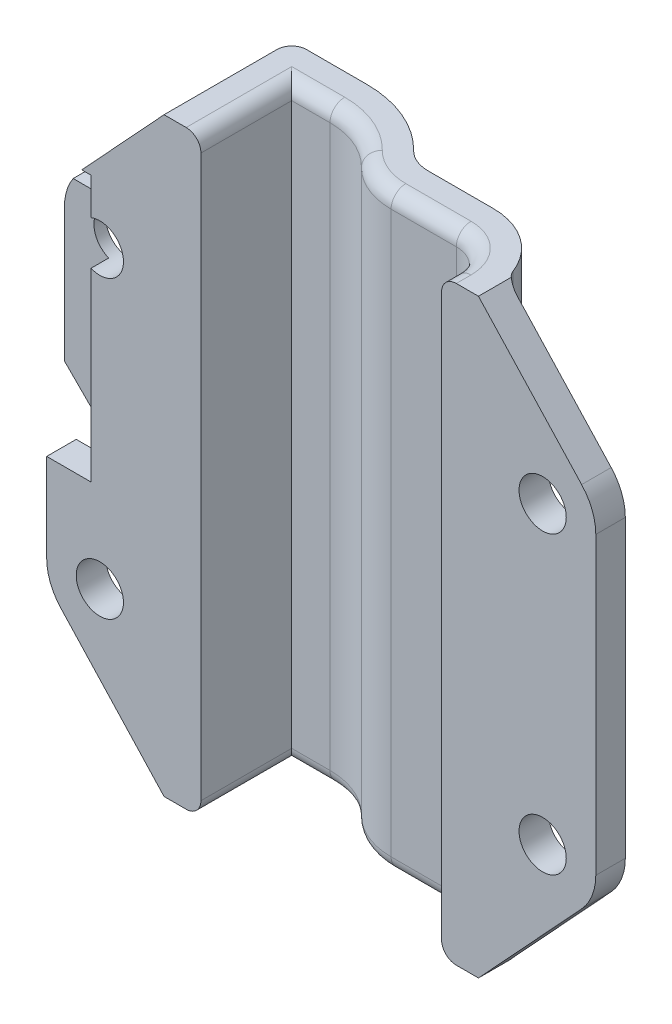
from build123d import *

# Parameters (mm, degrees)
BOSS_EXTRUDE1_DEPTH     = 40
BOSS_EXTRUDE2_START     = -2
BOSS_EXTRUDE2_OUTLINE_R = 1.6
BOSS_EXTRUDE2_DEPTH     = 2
FILLET1_R               = 1
FILLET2_R               = 1
SKETCH3_W               = 1.2
SKETCH3_H               = 2
SKETCH3_W_2             = 23.413110463
SKETCH3_H_2             = 14
CUT_EXTRUDE1_DEPTH      = 3
CHAMFER1_SIZE           = 3


# Read off the part's stored shape, not the designer's step: Boss-Extrude2
with BuildPart() as part:
    # Sketch1 → Boss-Extrude1 (new body)
    with BuildSketch(Plane(origin=(0, 0, 0), x_dir=(1, 0, 0), z_dir=(0, 1, 0))):
        with BuildLine():
            ThreePointArc((7.904340014, 6.355), (8.672424609, 5.833407053), (9.582575695, 5.65))
            Line((9.582575695, 5.65), (14, 5.65))
            ThreePointArc((14, 5.65), (17.288046533, 4.288046533), (18.65, 1))
            Line((18.65, 1), (18.65, 0))
            Line((18.65, 0), (16.15, 0))
            Line((16.15, 0), (16.15, 1))
            ThreePointArc((16.15, 1), (15.52027958, 2.52027958), (14, 3.15))
            Line((14, 3.15), (9.582575695, 3.15))
            ThreePointArc((9.582575695, 3.15), (7.704178772, 3.528520938), (6.118982907, 4.605))
            ThreePointArc((6.118982907, 4.605), (4.43573369, 5.748065396), (2.441147266, 6.15))
            Line((2.441147266, 6.15), (-0.15, 6.15))
            Line((-0.15, 6.15), (-0.15, 0))
            Line((-0.15, 0), (-2.65, 0))
            Line((-2.65, 0), (-2.65, 8.65))
            Line((-2.65, 8.65), (2.441147266, 8.65))
            ThreePointArc((2.441147266, 8.65), (5.403979526, 8.05295151), (7.904340014, 6.355))
        make_face()
    extrude(amount=BOSS_EXTRUDE1_DEPTH)

    # Boss-Extrude2 outline → Boss-Extrude2 (add)
    # profile 1 of 2: a face of its own
    with BuildSketch(Plane.XY.offset(BOSS_EXTRUDE2_START)):
        with BuildLine():
            Line((-2.65, 40), (-9.642066198, 32.445298796))
            ThreePointArc((-9.642066198, 32.445298796), (-10.351972428, 31.313118747), (-10.6, 30))
            Line((-10.6, 30), (-10.6, 10))
            ThreePointArc((-10.6, 10), (-10.351972428, 8.686881253), (-9.642066198, 7.554701204))
            Line((-9.642066198, 7.554701204), (-2.65, 0))
            Line((-2.65, 0), (-2.65, 40))
        make_face()
        with Locations((-7, 10)):
            Circle(BOSS_EXTRUDE2_OUTLINE_R, mode=Mode.SUBTRACT)
        with Locations((-7, 30)):
            Circle(BOSS_EXTRUDE2_OUTLINE_R, mode=Mode.SUBTRACT)
    # profile 2 of 2: a face of its own
    with BuildSketch(Plane.XY.offset(BOSS_EXTRUDE2_START)):
        with BuildLine():
            Line((26.6, 10), (26.6, 30))
            ThreePointArc((26.6, 30), (26.351972428, 31.313118747), (25.642066198, 32.445298796))
            Line((25.642066198, 32.445298796), (18.65, 40))
            Line((18.65, 40), (16.15, 40))
            Line((16.15, 40), (16.15, 0))
            Line((16.15, 0), (18.65, 0))
            Line((18.65, 0), (25.642066198, 7.554701204))
            ThreePointArc((25.642066198, 7.554701204), (26.351972428, 8.686881253), (26.6, 10))
        make_face()
        with Locations((23, 30)):
            Circle(BOSS_EXTRUDE2_OUTLINE_R, mode=Mode.SUBTRACT)
        with Locations((23, 10)):
            Circle(BOSS_EXTRUDE2_OUTLINE_R, mode=Mode.SUBTRACT)
    extrude(amount=BOSS_EXTRUDE2_DEPTH)

    # Fillet1
    fillet1_edges = [part.edges().sort_by_distance(p)[0] for p in [
        (-2.65, 20, -2),
        (-2.65, 20, -8.65),
        (18.541200282, 20, -2),
    ]]
    fillet(fillet1_edges, radius=FILLET1_R)

    # Fillet2
    fillet2_edges = [part.edges().sort_by_distance(p)[0] for p in [
        (16.15, 0, -0.5),
        (15.52027958, 0, -2.52027958),
        (11.791287847, 0, -3.15),
        (7.704178772, 0, -3.528520938),
        (4.43573369, 0, -5.748065396),
        (1.145573633, 0, -6.15),
        (-0.15, 0, -3.075),
        (-0.15, 40, -3.075),
        (1.145573633, 40, -6.15),
        (4.43573369, 40, -5.748065396),
        (7.704178772, 40, -3.528520938),
        (11.791287847, 40, -3.15),
        (15.52027958, 40, -2.52027958),
        (16.15, 40, -0.5),
    ]]
    fillet(fillet2_edges, radius=FILLET2_R)

    # Sketch3 → Cut-Extrude1 (cut)
    with BuildSketch(Plane.ZY.offset(10.6)):
        with Locations((-0.6, 32.977751257)):
            Rectangle(SKETCH3_W, SKETCH3_H)
        with Locations((-12.906555232, 32.977751257)):
            Rectangle(SKETCH3_W_2, SKETCH3_H)
        with Locations((-0.6, 24.977751257)):
            Rectangle(SKETCH3_W, SKETCH3_H_2)
        Polygon((0, 15.977751257), (0, 17.977751257), (-1.2, 17.977751257), (-15.374287906, 17.977751257), (-15.374287906, 15.977751257), align=None)
    extrude(amount=-CUT_EXTRUDE1_DEPTH, mode=Mode.SUBTRACT)

    # Chamfer1
    chamfer1_edges = [part.edges().sort_by_distance(p)[0] for p in [
        (-10.6, 17.977751257, -1.6),
    ]]
    chamfer(chamfer1_edges, length=CHAMFER1_SIZE - 0.0001)  # a hair under: the kernel refuses the full size


solid = part.part
